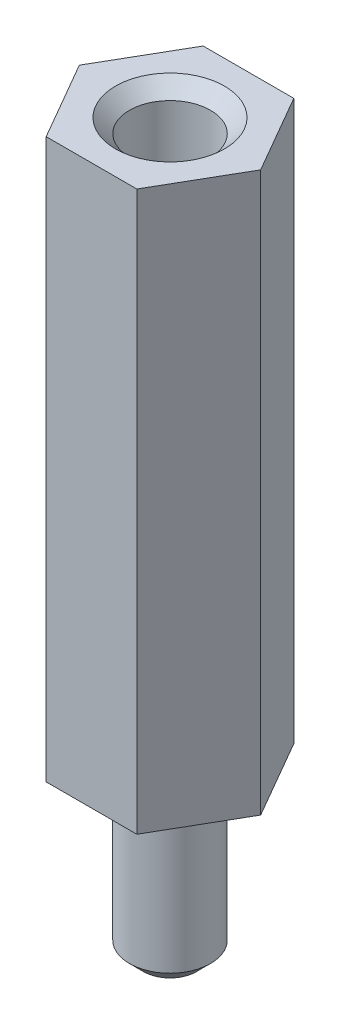
from build123d import *

# Parameters (mm, degrees)
BOSS_EXTRUDE1_DEPTH = 20
SKETCH2_R           = 1.45
BOSS_EXTRUDE2_DEPTH = 6
SKETCH3_R           = 1.45
CUT_EXTRUDE1_DEPTH  = 5
CHAMFER1_SIZE       = 0.5


with BuildPart() as part:
    # Sketch1 → Boss-Extrude1 (new body)
    with BuildSketch(Plane(origin=(0, 0, 0), x_dir=(1, 0, 0), z_dir=(0, 1, 0))):
        Polygon((3.244708513, 0), (1.622354256, 2.81), (-1.622354256, 2.81), (-3.244708513, 0), (-1.622354256, -2.81), (1.622354256, -2.81), align=None)
    extrude(amount=BOSS_EXTRUDE1_DEPTH)

    # Sketch2 → Boss-Extrude2 (add)
    with BuildSketch(Plane.XZ):
        Circle(SKETCH2_R)
    extrude(amount=BOSS_EXTRUDE2_DEPTH)

    # Sketch3 → Cut-Extrude1 (cut)
    with BuildSketch(Plane(origin=(0, 20, 0), x_dir=(1, 0, 0), z_dir=(0, 1, 0))):
        Circle(SKETCH3_R)
    extrude(amount=-CUT_EXTRUDE1_DEPTH, mode=Mode.SUBTRACT)

    # Chamfer1
    chamfer1_edges = [part.edges().sort_by_distance(p)[0] for p in [
        (-1.45, -6, 0),
        (-1.45, 20, 0),
    ]]
    chamfer(chamfer1_edges, length=CHAMFER1_SIZE)


solid = part.part
